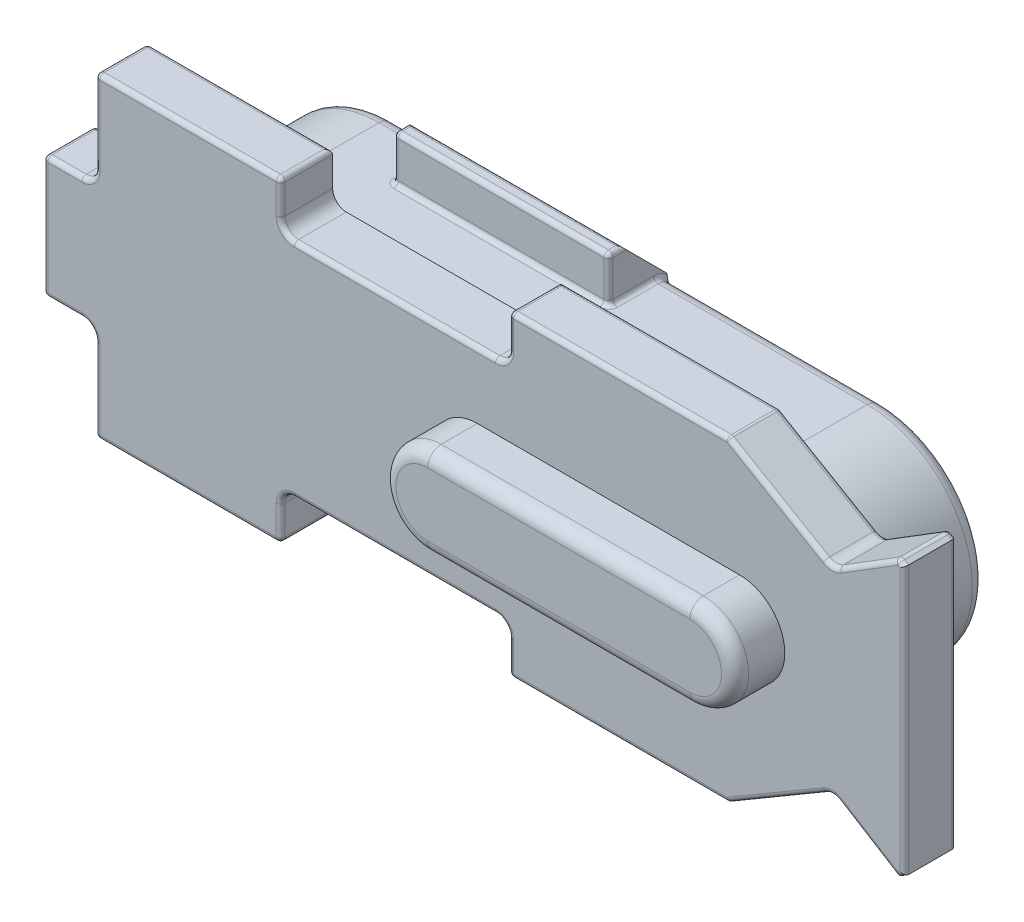
from build123d import *

# Parameters (mm, degrees)
BOSS_EXTRUDE1_DEPTH = 2.921
BOSS_EXTRUDE2_DEPTH = 2.794
BOSS_EXTRUDE3_DEPTH = 6.35
SKETCH4_W           = 12.065
SKETCH4_H           = 2.54
BOSS_EXTRUDE4_DEPTH = 3.302
CUT_EXTRUDE2_DEPTH  = 41.040883374
FILLET1_R           = 0.762
FILLET2_R           = 0.254


with BuildPart() as part:
    # Sketch1 → Boss-Extrude1 (new body)
    with BuildSketch(Plane.XY):
        Polygon((0, -12.319), (0, -5.461), (2.921, -5.461), (2.921, 0), (13.335, 0), (13.335, -2.667), (26.162, -2.667), (26.162, 0), (38.481, 0), (44.323, -3.429), (48.006, -1.143), (48.374224138, -1.359131559), (48.374224138, -16.420868441), (48.006, -16.637), (44.323, -14.351), (38.481, -17.78), (26.162, -17.78), (26.162, -15.113), (13.335, -15.113), (13.335, -17.78), (2.921, -17.78), (2.921, -12.319), align=None)
    extrude(amount=-BOSS_EXTRUDE1_DEPTH)

    # Sketch2 → Boss-Extrude2 (add)
    with BuildSketch(Plane.XY):
        with BuildLine():
            Line((39.116, -11.43), (24.384, -11.43))
            ThreePointArc((24.384, -11.43), (21.844, -8.89), (24.384, -6.35))
            Line((24.384, -6.35), (39.116, -6.35))
            ThreePointArc((39.116, -6.35), (41.656, -8.89), (39.116, -11.43))
        make_face()
    extrude(amount=BOSS_EXTRUDE2_DEPTH)

    # Sketch3 → Boss-Extrude3 (add)
    with BuildSketch(Plane(origin=(0, 0, -2.921), x_dir=(-1, 0, 0), z_dir=(0, 0, -1))):
        with BuildLine():
            Line((-37.7825, -2.9845), (-10.3505, -2.9845))
            ThreePointArc((-10.3505, -2.9845), (-4.445, -8.89), (-10.3505, -14.7955))
            Line((-10.3505, -14.7955), (-37.7825, -14.7955))
            ThreePointArc((-37.7825, -14.7955), (-43.688, -8.89), (-37.7825, -2.9845))
        make_face()
    extrude(amount=BOSS_EXTRUDE3_DEPTH)

    # Sketch4 → Boss-Extrude4 (add)
    with BuildSketch(Plane(origin=(0, 0, -9.271), x_dir=(-1, 0, 0), z_dir=(0, 0, -1))):
        with Locations((-19.7485, -1.7145)):
            Rectangle(SKETCH4_W, SKETCH4_H)
        with Locations((-19.7485, -16.0655)):
            Rectangle(SKETCH4_W, SKETCH4_H)
    extrude(amount=-BOSS_EXTRUDE4_DEPTH)

    # Sketch5 → Cut-Extrude2 (cut, through all)
    with BuildSketch(Plane.ZY.offset(-13.716)):
        Polygon((-9.271, -2.9845), (-6.731, -0.4445), (-9.271, -0.4445), align=None)
        Polygon((-9.271, -17.3355), (-9.271, -14.7955), (-6.731, -17.3355), align=None)
    extrude(amount=-CUT_EXTRUDE2_DEPTH, mode=Mode.SUBTRACT)

    # Fillet1
    fillet1_edges = [part.edges().sort_by_distance(p)[0] for p in [
        (13.335, -2.667, -1.4605),
        (26.162, -2.667, -1.4605),
        (44.323, -3.429, -1.4605),
        (44.323, -14.351, -1.4605),
        (26.162, -15.113, -1.4605),
        (13.335, -15.113, -1.4605),
        (2.921, -12.319, -1.4605),
        (2.921, -5.461, -1.4605),
        (41.656, -8.89, 2.794),
        (31.75, -6.35, 2.794),
        (21.844, -8.89, 2.794),
        (31.75, -11.43, 2.794),
        (43.688, -8.89, -9.271),
        (31.78175, -14.7955, -9.271),
        (4.445, -8.89, -9.271),
        (12.03325, -2.9845, -9.271),
        (31.78175, -2.9845, -9.271),
        (12.03325, -14.7955, -9.271),
    ]]
    fillet(fillet1_edges, radius=FILLET1_R)

    # Fillet2
    # the kernel refuses this fillet: 0.254 mm, written as the material it adds along each edge
    with BuildSketch(Plane(origin=(25.781, -14.0335, -8.509), x_dir=(0, -1, 0), z_dir=(0, 0, 1))) as fillet2_piece_1_section:
        with BuildLine():
            CenterArc((0.762 + FILLET2_R, FILLET2_R), FILLET2_R, 180, 90)
            Line((0.762 + FILLET2_R, 0), (0.762, 0))
            Line((0.762, 0), (0.762, FILLET2_R))
        make_face()
    fillet2_piece_1 = revolve(axis=Axis((25.781, -14.0335, -8.509), (1, 0, 0)), revolution_arc=137.765663079, mode=Mode.PRIVATE)
    fillet2_piece_1 = split(fillet2_piece_1, bisect_by=Plane(origin=(25.781, -14.0335, -9.271), z_dir=(0, 0, 1)), keep=Keep.TOP, mode=Mode.PRIVATE)
    add(fillet2_piece_1)
    with BuildSketch(Plane(origin=(13.716, -14.0335, -8.509), x_dir=(0, -1, 0), z_dir=(0, 0, 1))) as fillet2_piece_2_section:
        with BuildLine():
            CenterArc((0.762 + FILLET2_R, -FILLET2_R), FILLET2_R, 90, 90)
            Line((0.762 + FILLET2_R, 0), (0.762, 0))
            Line((0.762, 0), (0.762, -FILLET2_R))
        make_face()
    fillet2_piece_2 = revolve(axis=Axis((13.716, -14.0335, -8.509), (1, 0, 0)), revolution_arc=137.765663079, mode=Mode.PRIVATE)
    fillet2_piece_2 = split(fillet2_piece_2, bisect_by=Plane(origin=(13.716, -14.0335, -9.271), z_dir=(0, 0, 1)), keep=Keep.TOP, mode=Mode.PRIVATE)
    add(fillet2_piece_2)
    with BuildSketch(Plane(origin=(10.3505, -14.7955, -2.921), x_dir=(0, -1, 0), z_dir=(1, 0, 0)), Plane(origin=(37.7825, -2.9845, -2.921), x_dir=(0, 1, 0), z_dir=(-1, 0, 0))) as fillet2_piece_3:
        with BuildLine():
            CenterArc((FILLET2_R, FILLET2_R), FILLET2_R, 180, 90)
            Line((0, FILLET2_R), (0, 0))
            Line((0, 0), (FILLET2_R, 0))
        make_face()
    extrude(amount=27.432)
    with BuildSketch(Plane(origin=(37.7825, -8.89, -2.921), x_dir=(0, -1, 0), z_dir=(-1, 0, 0))) as fillet2_piece_4:
        with BuildLine():
            CenterArc((5.9055 + FILLET2_R, -FILLET2_R), FILLET2_R, 90, 90)
            Line((5.9055, -FILLET2_R), (5.9055, 0))
            Line((5.9055, 0), (5.9055 + FILLET2_R, 0))
        make_face()
    revolve(axis=Axis((37.7825, -8.89, -2.921), (0, 0, 1)), revolution_arc=180)
    with BuildSketch(Plane(origin=(25.781, -14.7955, -8.509), x_dir=(1, 0, 0), z_dir=(0, 0, 1))) as fillet2_piece_5:
        with BuildLine():
            CenterArc((FILLET2_R, -FILLET2_R), FILLET2_R, 90, 90)
            Line((0, -FILLET2_R), (0, 0))
            Line((0, 0), (FILLET2_R, 0))
        make_face()
    extrude(amount=2.54)
    with BuildSketch(Plane(origin=(13.716, -14.7955, -8.509), x_dir=(-1, 0, 0), z_dir=(0, 0, 1))) as fillet2_piece_6:
        with BuildLine():
            CenterArc((FILLET2_R, FILLET2_R), FILLET2_R, 180, 90)
            Line((0, FILLET2_R), (0, 0))
            Line((0, 0), (FILLET2_R, 0))
        make_face()
    extrude(amount=2.54)
    with BuildSketch(Plane(origin=(25.781, -14.7955, -5.969), x_dir=(0, 0, 1), z_dir=(-1, 0, 0))) as fillet2_piece_7:
        with BuildLine():
            CenterArc((FILLET2_R, -FILLET2_R), FILLET2_R, 90, 90)
            Line((0, -FILLET2_R), (0, 0))
            Line((0, 0), (FILLET2_R, 0))
        make_face()
    extrude(amount=12.065)
    with BuildSketch(Plane(origin=(10.3505, -8.89, -2.921), x_dir=(0, 1, 0), z_dir=(1, 0, 0))) as fillet2_piece_8:
        with BuildLine():
            CenterArc((5.9055 + FILLET2_R, -FILLET2_R), FILLET2_R, 90, 90)
            Line((5.9055, -FILLET2_R), (5.9055, 0))
            Line((5.9055, 0), (5.9055 + FILLET2_R, 0))
        make_face()
    revolve(axis=Axis((10.3505, -8.89, -2.921), (0, 0, 1)), revolution_arc=180)
    with BuildSketch(Plane(origin=(25.781, -14.7955, -8.509), x_dir=(1, 0, 0), z_dir=(0, 0, 1))) as fillet2_piece_9a_section:
        with BuildLine():
            CenterArc((FILLET2_R, -FILLET2_R), FILLET2_R, 90, 90)
            Line((0, -FILLET2_R), (0, 0))
            Line((0, 0), (FILLET2_R, 0))
        make_face()
    fillet2_piece_9a = extrude(amount=3.175, mode=Mode.PRIVATE)
    fillet2_piece_9a = split(fillet2_piece_9a, bisect_by=Plane(origin=(25.781, -14.7955, -5.969), z_dir=(0, 0, 1)), keep=Keep.TOP, mode=Mode.PRIVATE)
    with BuildSketch(Plane(origin=(26.416, -14.7955, -5.969), x_dir=(0, 0, 1), z_dir=(-1, 0, 0))) as fillet2_piece_9b_section:
        with BuildLine():
            CenterArc((FILLET2_R, -FILLET2_R), FILLET2_R, 90, 90)
            Line((0, -FILLET2_R), (0, 0))
            Line((0, 0), (FILLET2_R, 0))
        make_face()
    fillet2_piece_9b = extrude(amount=12.7, mode=Mode.PRIVATE)
    fillet2_piece_9b = split(fillet2_piece_9b, bisect_by=Plane(origin=(25.781, -14.7955, -5.969), z_dir=(1, 0, 0)), keep=Keep.TOP, mode=Mode.PRIVATE)
    fillet2_piece_9 = fillet2_piece_9a & fillet2_piece_9b
    add(fillet2_piece_9)
    with BuildSketch(Plane(origin=(25.781, -14.7955, -5.969), x_dir=(0, 0, 1), z_dir=(-1, 0, 0))) as fillet2_piece_10a_section:
        with BuildLine():
            CenterArc((FILLET2_R, -FILLET2_R), FILLET2_R, 90, 90)
            Line((0, -FILLET2_R), (0, 0))
            Line((0, 0), (FILLET2_R, 0))
        make_face()
    fillet2_piece_10a = extrude(amount=12.7, mode=Mode.PRIVATE)
    fillet2_piece_10a = split(fillet2_piece_10a, bisect_by=Plane(origin=(13.716, -14.7955, -5.969), z_dir=(-1, 0, 0)), keep=Keep.TOP, mode=Mode.PRIVATE)
    with BuildSketch(Plane(origin=(13.716, -14.7955, -8.509), x_dir=(-1, 0, 0), z_dir=(0, 0, 1))) as fillet2_piece_10b_section:
        with BuildLine():
            CenterArc((FILLET2_R, FILLET2_R), FILLET2_R, 180, 90)
            Line((0, FILLET2_R), (0, 0))
            Line((0, 0), (FILLET2_R, 0))
        make_face()
    fillet2_piece_10b = extrude(amount=3.175, mode=Mode.PRIVATE)
    fillet2_piece_10b = split(fillet2_piece_10b, bisect_by=Plane(origin=(13.716, -14.7955, -5.969), z_dir=(0, 0, 1)), keep=Keep.TOP, mode=Mode.PRIVATE)
    fillet2_piece_10 = fillet2_piece_10a & fillet2_piece_10b
    add(fillet2_piece_10)
    # the kernel refuses this fillet: 0.254 mm, written as the material it takes off along each edge
    with BuildSketch(Plane(origin=(48.009667112, -1.439673947, -2.667), x_dir=(-0.5273628617781428, 0.8496401661981191, 0), z_dir=(0, 0, -1))) as fillet2_2_piece_1_section:
        Polygon((0, 0), (FILLET2_R * 1.02, 0), (FILLET2_R * 1.02, FILLET2_R * 0.615771172164), (FILLET2_R * 0.475107543506, FILLET2_R * 0.902592278996), align=None)
    fillet2_2_piece_1 = extrude(amount=FILLET2_R * 1.02, mode=Mode.PRIVATE)
    fillet2_2_piece_1 = fillet2_2_piece_1 - Plane(origin=(48.009667112, -1.439673947, -2.667), x_dir=(0.012359804319251886, -0.9999236147012379, 0), z_dir=(0, 0, -1)) * Sphere(FILLET2_R, mode=Mode.PRIVATE)
    add(fillet2_2_piece_1, mode=Mode.SUBTRACT)
    with BuildSketch(Plane(origin=(0.254, -5.715, -2.667), x_dir=(-1, 0, 0), z_dir=(0, 0, -1))) as fillet2_2_piece_2_section:
        Polygon((0, 0), (FILLET2_R * 1.02, 0), (FILLET2_R * 1.02, FILLET2_R * 1.02), (0, FILLET2_R * 1.02), align=None)
    fillet2_2_piece_2 = extrude(amount=FILLET2_R * 1.02, mode=Mode.PRIVATE)
    fillet2_2_piece_2 = fillet2_2_piece_2 - Plane(origin=(0.254, -5.715, -2.667), x_dir=(0.7071067811865474, -0.7071067811865477, 0), z_dir=(0, 0, -1)) * Sphere(FILLET2_R, mode=Mode.PRIVATE)
    add(fillet2_2_piece_2, mode=Mode.SUBTRACT)
    with BuildSketch(Plane(origin=(0.254, -12.065, -2.667), x_dir=(0, 0, -1), z_dir=(0, -1, 0))) as fillet2_2_piece_3_section:
        Polygon((0, 0), (FILLET2_R * 1.02, 0), (FILLET2_R * 1.02, -FILLET2_R * 1.02), (0, -FILLET2_R * 1.02), align=None)
    fillet2_2_piece_3 = extrude(amount=FILLET2_R * 1.02, mode=Mode.PRIVATE)
    fillet2_2_piece_3 = fillet2_2_piece_3 - Plane(origin=(0.254, -12.065, -2.667), x_dir=(0.7071067811865475, 0, 0.7071067811865475), z_dir=(0, -1, 0)) * Sphere(FILLET2_R, mode=Mode.PRIVATE)
    add(fillet2_2_piece_3, mode=Mode.SUBTRACT)
    with BuildSketch(Plane(origin=(13.97, -0.6985, -6.223), x_dir=(0, 1, 0), z_dir=(0, 0, 1))) as fillet2_2_piece_4_section:
        Polygon((0, 0), (FILLET2_R * 1.02, 0), (FILLET2_R * 1.02, FILLET2_R * 1.02), (0, FILLET2_R * 1.02), align=None)
    fillet2_2_piece_4 = extrude(amount=FILLET2_R * 1.02, mode=Mode.PRIVATE)
    fillet2_2_piece_4 = fillet2_2_piece_4 - Plane(origin=(13.97, -0.6985, -6.223), x_dir=(0.707106781186548, -0.707106781186547, 0), z_dir=(0, 0, 1)) * Sphere(FILLET2_R, mode=Mode.PRIVATE)
    add(fillet2_2_piece_4, mode=Mode.SUBTRACT)
    with BuildSketch(Plane(origin=(25.527, -0.6985, -6.223), x_dir=(0, 1, 0), z_dir=(0, 0, 1))) as fillet2_2_piece_5_section:
        Polygon((0, 0), (FILLET2_R * 1.02, 0), (FILLET2_R * 1.02, -FILLET2_R * 1.02), (0, -FILLET2_R * 1.02), align=None)
    fillet2_2_piece_5 = extrude(amount=FILLET2_R * 1.02, mode=Mode.PRIVATE)
    fillet2_2_piece_5 = fillet2_2_piece_5 - Plane(origin=(25.527, -0.6985, -6.223), x_dir=(-0.7071067811865475, -0.7071067811865475, 0), z_dir=(0, 0, 1)) * Sphere(FILLET2_R, mode=Mode.PRIVATE)
    add(fillet2_2_piece_5, mode=Mode.SUBTRACT)
    with BuildSketch(Plane(origin=(3.175, -0.254, -0.254), x_dir=(0, 1, 0), z_dir=(-1, 0, 0))) as fillet2_2_piece_6_section:
        Polygon((0, 0), (FILLET2_R * 1.02, 0), (FILLET2_R * 1.02, -FILLET2_R * 1.02), (0, -FILLET2_R * 1.02), align=None)
    fillet2_2_piece_6 = extrude(amount=FILLET2_R * 1.02, mode=Mode.PRIVATE)
    fillet2_2_piece_6 = fillet2_2_piece_6 - Plane(origin=(3.175, -0.254, -0.254), x_dir=(0, -0.7071067811865475, -0.7071067811865475), z_dir=(-1, 0, 0)) * Sphere(FILLET2_R, mode=Mode.PRIVATE)
    add(fillet2_2_piece_6, mode=Mode.SUBTRACT)
    with BuildSketch(Plane(origin=(13.081, -0.254, -0.254), x_dir=(0, 1, 0), z_dir=(1, 0, 0))) as fillet2_2_piece_7_section:
        Polygon((0, 0), (FILLET2_R * 1.02, 0), (FILLET2_R * 1.02, FILLET2_R * 1.02), (0, FILLET2_R * 1.02), align=None)
    fillet2_2_piece_7 = extrude(amount=FILLET2_R * 1.02, mode=Mode.PRIVATE)
    fillet2_2_piece_7 = fillet2_2_piece_7 - Plane(origin=(13.081, -0.254, -0.254), x_dir=(0, -0.7071067811865475, -0.7071067811865475), z_dir=(1, 0, 0)) * Sphere(FILLET2_R, mode=Mode.PRIVATE)
    add(fillet2_2_piece_7, mode=Mode.SUBTRACT)
    with BuildSketch(Plane(origin=(26.416, -0.254, -0.254), x_dir=(0, 0, 1), z_dir=(-1, 0, 0))) as fillet2_2_piece_8_section:
        Polygon((0, 0), (FILLET2_R * 1.02, 0), (FILLET2_R * 1.02, FILLET2_R * 1.02), (0, FILLET2_R * 1.02), align=None)
    fillet2_2_piece_8 = extrude(amount=FILLET2_R * 1.02, mode=Mode.PRIVATE)
    fillet2_2_piece_8 = fillet2_2_piece_8 - Plane(origin=(26.416, -0.254, -0.254), x_dir=(0, -0.7071067811865475, -0.7071067811865475), z_dir=(-1, 0, 0)) * Sphere(FILLET2_R, mode=Mode.PRIVATE)
    add(fillet2_2_piece_8, mode=Mode.SUBTRACT)
    with BuildSketch(Plane(origin=(38.411963351, -0.254, -0.254), x_dir=(0, 1, 0), z_dir=(0, 0, 1))) as fillet2_2_piece_9_section:
        Polygon((0, 0), (FILLET2_R * 1.02, 0), (FILLET2_R * 1.02, -FILLET2_R * 0.27723378669), (FILLET2_R * 0.879664099497, -FILLET2_R * 0.51632458014), align=None)
    fillet2_2_piece_9 = extrude(amount=FILLET2_R * 1.02, mode=Mode.PRIVATE)
    fillet2_2_piece_9 = fillet2_2_piece_9 - Plane(origin=(38.411963351, -0.254, -0.254), x_dir=(-0.26228249672773757, -0.964991135664087, 0), z_dir=(0, 0, 1)) * Sphere(FILLET2_R, mode=Mode.PRIVATE)
    add(fillet2_2_piece_9, mode=Mode.SUBTRACT)
    with BuildSketch(Plane(origin=(48.009667112, -1.439673947, -0.254), x_dir=(0.5062005687642271, 0.8624157838205264, 0), z_dir=(0, 0, 1))) as fillet2_2_piece_10_section:
        Polygon((0, 0), (FILLET2_R * 1.02, 0), (FILLET2_R * 1.02, FILLET2_R * 0.615771172164), (FILLET2_R * 0.475107543506, FILLET2_R * 0.902592278996), align=None)
    fillet2_2_piece_10 = extrude(amount=FILLET2_R * 1.02, mode=Mode.PRIVATE)
    fillet2_2_piece_10 = fillet2_2_piece_10 - Plane(origin=(48.009667112, -1.439673947, -0.254), x_dir=(0.012359804319251886, -0.9999236147012379, 0), z_dir=(0, 0, 1)) * Sphere(FILLET2_R, mode=Mode.PRIVATE)
    add(fillet2_2_piece_10, mode=Mode.SUBTRACT)
    with BuildSketch(Plane(origin=(38.411963351, -17.526, -0.254), x_dir=(0.5062005687642233, -0.8624157838205287, 0), z_dir=(0, 0, 1))) as fillet2_2_piece_11_section:
        Polygon((0, 0), (FILLET2_R * 1.02, 0), (FILLET2_R * 1.02, -FILLET2_R * 0.27723378669), (FILLET2_R * 0.879664099497, -FILLET2_R * 0.51632458014), align=None)
    fillet2_2_piece_11 = extrude(amount=FILLET2_R * 1.02, mode=Mode.PRIVATE)
    fillet2_2_piece_11 = fillet2_2_piece_11 - Plane(origin=(38.411963351, -17.526, -0.254), x_dir=(-0.2622824967277375, 0.964991135664087, 0), z_dir=(0, 0, 1)) * Sphere(FILLET2_R, mode=Mode.PRIVATE)
    add(fillet2_2_piece_11, mode=Mode.SUBTRACT)
    with BuildSketch(Plane(origin=(26.416, -17.526, -0.254), x_dir=(0, 0, 1), z_dir=(0, -1, 0))) as fillet2_2_piece_12_section:
        Polygon((0, 0), (FILLET2_R * 1.02, 0), (FILLET2_R * 1.02, FILLET2_R * 1.02), (0, FILLET2_R * 1.02), align=None)
    fillet2_2_piece_12 = extrude(amount=FILLET2_R * 1.02, mode=Mode.PRIVATE)
    fillet2_2_piece_12 = fillet2_2_piece_12 - Plane(origin=(26.416, -17.526, -0.254), x_dir=(0.7071067811865475, 0, -0.7071067811865475), z_dir=(0, -1, 0)) * Sphere(FILLET2_R, mode=Mode.PRIVATE)
    add(fillet2_2_piece_12, mode=Mode.SUBTRACT)
    with BuildSketch(Plane(origin=(13.081, -17.526, -0.254), x_dir=(0, 0, 1), z_dir=(0, -1, 0))) as fillet2_2_piece_13_section:
        Polygon((0, 0), (FILLET2_R * 1.02, 0), (FILLET2_R * 1.02, -FILLET2_R * 1.02), (0, -FILLET2_R * 1.02), align=None)
    fillet2_2_piece_13 = extrude(amount=FILLET2_R * 1.02, mode=Mode.PRIVATE)
    fillet2_2_piece_13 = fillet2_2_piece_13 - Plane(origin=(13.081, -17.526, -0.254), x_dir=(-0.7071067811865475, 0, -0.7071067811865475), z_dir=(0, -1, 0)) * Sphere(FILLET2_R, mode=Mode.PRIVATE)
    add(fillet2_2_piece_13, mode=Mode.SUBTRACT)
    with BuildSketch(Plane(origin=(3.175, -17.526, -0.254), x_dir=(-1, 0, 0), z_dir=(0, -1, 0))) as fillet2_2_piece_14_section:
        Polygon((0, 0), (FILLET2_R * 1.02, 0), (FILLET2_R * 1.02, -FILLET2_R * 1.02), (0, -FILLET2_R * 1.02), align=None)
    fillet2_2_piece_14 = extrude(amount=FILLET2_R * 1.02, mode=Mode.PRIVATE)
    fillet2_2_piece_14 = fillet2_2_piece_14 - Plane(origin=(3.175, -17.526, -0.254), x_dir=(0.7071067811865475, 0, -0.7071067811865475), z_dir=(0, -1, 0)) * Sphere(FILLET2_R, mode=Mode.PRIVATE)
    add(fillet2_2_piece_14, mode=Mode.SUBTRACT)
    with BuildSketch(Plane(origin=(0.254, -12.065, -0.254), x_dir=(-1, 0, 0), z_dir=(0, -1, 0))) as fillet2_2_piece_15_section:
        Polygon((0, 0), (FILLET2_R * 1.02, 0), (FILLET2_R * 1.02, -FILLET2_R * 1.02), (0, -FILLET2_R * 1.02), align=None)
    fillet2_2_piece_15 = extrude(amount=FILLET2_R * 1.02, mode=Mode.PRIVATE)
    fillet2_2_piece_15 = fillet2_2_piece_15 - Plane(origin=(0.254, -12.065, -0.254), x_dir=(0.7071067811865475, 0, -0.7071067811865475), z_dir=(0, -1, 0)) * Sphere(FILLET2_R, mode=Mode.PRIVATE)
    add(fillet2_2_piece_15, mode=Mode.SUBTRACT)
    with BuildSketch(Plane(origin=(0.254, -5.715, -0.254), x_dir=(-1, 0, 0), z_dir=(0, 1, 0))) as fillet2_2_piece_16_section:
        Polygon((0, 0), (FILLET2_R * 1.02, 0), (FILLET2_R * 1.02, FILLET2_R * 1.02), (0, FILLET2_R * 1.02), align=None)
    fillet2_2_piece_16 = extrude(amount=FILLET2_R * 1.02, mode=Mode.PRIVATE)
    fillet2_2_piece_16 = fillet2_2_piece_16 - Plane(origin=(0.254, -5.715, -0.254), x_dir=(0.7071067811865475, 0, -0.7071067811865475), z_dir=(0, 1, 0)) * Sphere(FILLET2_R, mode=Mode.PRIVATE)
    add(fillet2_2_piece_16, mode=Mode.SUBTRACT)
    with BuildSketch(Plane(origin=(38.411963351, -0.254, -2.667), x_dir=(0.5062005687642234, 0.8624157838205287, 0), z_dir=(0, 0, -1))) as fillet2_2_piece_17_section:
        Polygon((0, 0), (FILLET2_R * 1.02, 0), (FILLET2_R * 1.02, -FILLET2_R * 0.27723378669), (FILLET2_R * 0.879664099497, -FILLET2_R * 0.51632458014), align=None)
    fillet2_2_piece_17 = extrude(amount=FILLET2_R * 1.02, mode=Mode.PRIVATE)
    fillet2_2_piece_17 = fillet2_2_piece_17 - Plane(origin=(38.411963351, -0.254, -2.667), x_dir=(-0.26228249672773757, -0.964991135664087, 0), z_dir=(0, 0, -1)) * Sphere(FILLET2_R, mode=Mode.PRIVATE)
    add(fillet2_2_piece_17, mode=Mode.SUBTRACT)
    with BuildSketch(Plane(origin=(3.175, -0.254, -2.667), x_dir=(0, 1, 0), z_dir=(0, 0, -1))) as fillet2_2_piece_18_section:
        Polygon((0, 0), (FILLET2_R * 1.02, 0), (FILLET2_R * 1.02, -FILLET2_R * 1.02), (0, -FILLET2_R * 1.02), align=None)
    fillet2_2_piece_18 = extrude(amount=FILLET2_R * 1.02, mode=Mode.PRIVATE)
    fillet2_2_piece_18 = fillet2_2_piece_18 - Plane(origin=(3.175, -0.254, -2.667), x_dir=(0.7071067811865475, -0.7071067811865475, 0), z_dir=(0, 0, -1)) * Sphere(FILLET2_R, mode=Mode.PRIVATE)
    add(fillet2_2_piece_18, mode=Mode.SUBTRACT)
    with BuildSketch(Plane(origin=(3.175, -17.526, -2.667), x_dir=(0, 0, -1), z_dir=(0, -1, 0))) as fillet2_2_piece_19_section:
        Polygon((0, 0), (FILLET2_R * 1.02, 0), (FILLET2_R * 1.02, -FILLET2_R * 1.02), (0, -FILLET2_R * 1.02), align=None)
    fillet2_2_piece_19 = extrude(amount=FILLET2_R * 1.02, mode=Mode.PRIVATE)
    fillet2_2_piece_19 = fillet2_2_piece_19 - Plane(origin=(3.175, -17.526, -2.667), x_dir=(0.7071067811865475, 0, 0.7071067811865475), z_dir=(0, -1, 0)) * Sphere(FILLET2_R, mode=Mode.PRIVATE)
    add(fillet2_2_piece_19, mode=Mode.SUBTRACT)
    with BuildSketch(Plane(origin=(38.411963351, -17.526, -2.667), x_dir=(0.5062005687642233, -0.8624157838205287, 0), z_dir=(0, 0, -1))) as fillet2_2_piece_20_section:
        Polygon((0, 0), (FILLET2_R * 1.02, 0), (FILLET2_R * 1.02, FILLET2_R * 0.27723378669), (FILLET2_R * 0.879664099497, FILLET2_R * 0.51632458014), align=None)
    fillet2_2_piece_20 = extrude(amount=FILLET2_R * 1.02, mode=Mode.PRIVATE)
    fillet2_2_piece_20 = fillet2_2_piece_20 - Plane(origin=(38.411963351, -17.526, -2.667), x_dir=(-0.2622824967277375, 0.964991135664087, 0), z_dir=(0, 0, -1)) * Sphere(FILLET2_R, mode=Mode.PRIVATE)
    add(fillet2_2_piece_20, mode=Mode.SUBTRACT)
    with BuildSketch(Plane(origin=(44.713849165, -3.186403967, -2.921), x_dir=(0.5273628617781428, -0.8496401661981191, 0), z_dir=(0.8496401661981191, 0.5273628617781428, 0)), Plane(origin=(44.713849165, -3.186403967, 0), x_dir=(0, 0, -1), z_dir=(0.8496401661981191, 0.5273628617781428, 0))) as fillet2_2_piece_21:
        with BuildLine():
            CenterArc((FILLET2_R, -FILLET2_R), FILLET2_R, 90, 90)
            Line((0, -FILLET2_R), (0, 0))
            Line((0, 0), (FILLET2_R, 0))
        make_face()
    extrude(amount=3.721419851, mode=Mode.SUBTRACT)
    with BuildSketch(Plane(origin=(44.311998664, -2.53897816, -2.921), x_dir=(-0.5062005687642194, -0.8624157838205309, 0), z_dir=(-0.8624157838205309, 0.5062005687642194, 0))) as fillet2_2_piece_22:
        with BuildLine():
            CenterArc((0.762 + FILLET2_R, FILLET2_R), FILLET2_R, 180, 90)
            Line((0.762, FILLET2_R), (0.762, 0))
            Line((0.762, 0), (0.762 + FILLET2_R, 0))
        make_face()
    revolve(axis=Axis((44.311998664, -2.53897816, -2.921), (0, 0, 1)), revolution_arc=62.238527844, mode=Mode.SUBTRACT)
    with BuildSketch(Plane(origin=(0.254, -5.461, -2.921), x_dir=(0, -1, 0), z_dir=(1, 0, 0)), Plane(origin=(2.159, -12.319, 0), x_dir=(0, 0, -1), z_dir=(-1, 0, 0)), Plane(origin=(0.254, -5.461, 0), x_dir=(0, 0, -1), z_dir=(1, 0, 0))) as fillet2_2_piece_23:
        with BuildLine():
            CenterArc((FILLET2_R, -FILLET2_R), FILLET2_R, 90, 90)
            Line((0, -FILLET2_R), (0, 0))
            Line((0, 0), (FILLET2_R, 0))
        make_face()
    extrude(amount=1.905, mode=Mode.SUBTRACT)
    with BuildSketch(Plane(origin=(2.159, -4.699, -2.921), x_dir=(0, -1, 0), z_dir=(-1, 0, 0))) as fillet2_2_piece_24:
        with BuildLine():
            CenterArc((0.762 + FILLET2_R, FILLET2_R), FILLET2_R, 180, 90)
            Line((0.762, FILLET2_R), (0.762, 0))
            Line((0.762, 0), (0.762 + FILLET2_R, 0))
        make_face()
    revolve(axis=Axis((2.159, -4.699, -2.921), (0, 0, 1)), revolution_arc=90, mode=Mode.SUBTRACT)
    with BuildSketch(Plane(origin=(2.159, -12.319, -2.921), x_dir=(0, 0, 1), z_dir=(-1, 0, 0))) as fillet2_2_piece_25:
        with BuildLine():
            CenterArc((FILLET2_R, FILLET2_R), FILLET2_R, 180, 90)
            Line((0, FILLET2_R), (0, 0))
            Line((0, 0), (FILLET2_R, 0))
        make_face()
    extrude(amount=1.905, mode=Mode.SUBTRACT)
    with BuildSketch(Plane(origin=(2.159, -13.081, -2.921), x_dir=(0, 1, 0), z_dir=(-1, 0, 0))) as fillet2_2_piece_26:
        with BuildLine():
            CenterArc((0.762 + FILLET2_R, -FILLET2_R), FILLET2_R, 90, 90)
            Line((0.762, -FILLET2_R), (0.762, 0))
            Line((0.762, 0), (0.762 + FILLET2_R, 0))
        make_face()
    revolve(axis=Axis((2.159, -13.081, -2.921), (0, 0, -1)), revolution_arc=90, mode=Mode.SUBTRACT)
    with BuildSketch(Plane(origin=(48.545521506, -16.971875417, -2.921), x_dir=(0.5273628617781433, 0.849640166198119, 0), z_dir=(-0.849640166198119, 0.5273628617781432, 0)), Plane(origin=(48.545521506, -16.971875417, 0), x_dir=(0, 0, -1), z_dir=(-0.849640166198119, 0.5273628617781432, 0))) as fillet2_2_piece_27:
        with BuildLine():
            CenterArc((FILLET2_R, -FILLET2_R), FILLET2_R, 90, 90)
            Line((0, -FILLET2_R), (0, 0))
            Line((0, 0), (FILLET2_R, 0))
        make_face()
    extrude(amount=4.509758947, mode=Mode.SUBTRACT)
    with BuildSketch(Plane(origin=(44.311998664, -15.24102184, -2.921), x_dir=(-0.5062005687642191, 0.8624157838205311, 0), z_dir=(-0.8624157838205311, -0.5062005687642191, 0))) as fillet2_2_piece_28:
        with BuildLine():
            CenterArc((0.762 + FILLET2_R, -FILLET2_R), FILLET2_R, 90, 90)
            Line((0.762, -FILLET2_R), (0.762, 0))
            Line((0.762, 0), (0.762 + FILLET2_R, 0))
        make_face()
    revolve(axis=Axis((44.311998664, -15.24102184, -2.921), (0, 0, -1)), revolution_arc=62.238527844, mode=Mode.SUBTRACT)
    with BuildSketch(Plane(origin=(13.716, -2.9845, -5.969), x_dir=(1, 0, 0), z_dir=(0, 1, 0)), Plane(origin=(25.781, -0.6985, -5.969), x_dir=(-1, 0, 0), z_dir=(0, -1, 0))) as fillet2_2_piece_29:
        with BuildLine():
            CenterArc((FILLET2_R, FILLET2_R), FILLET2_R, 180, 90)
            Line((0, FILLET2_R), (0, 0))
            Line((0, 0), (FILLET2_R, 0))
        make_face()
    extrude(amount=2.286, mode=Mode.SUBTRACT)
    with BuildSketch(Plane(origin=(25.781, -0.4445, -7.366), x_dir=(-1, 0, 0), z_dir=(0, 0, 1))) as fillet2_2_piece_30:
        with BuildLine():
            CenterArc((FILLET2_R, FILLET2_R), FILLET2_R, 180, 90)
            Line((0, FILLET2_R), (0, 0))
            Line((0, 0), (FILLET2_R, 0))
        make_face()
    extrude(amount=1.143, mode=Mode.SUBTRACT)
    with BuildSketch(Plane(origin=(13.97, -0.4445, -5.969), x_dir=(0, -1, 0), z_dir=(1, 0, 0))) as fillet2_2_piece_31:
        with BuildLine():
            CenterArc((FILLET2_R, FILLET2_R), FILLET2_R, 180, 90)
            Line((0, FILLET2_R), (0, 0))
            Line((0, 0), (FILLET2_R, 0))
        make_face()
    extrude(amount=11.557, mode=Mode.SUBTRACT)
    with BuildSketch(Plane(origin=(13.716, -0.4445, -7.366), x_dir=(1, 0, 0), z_dir=(0, 0, 1))) as fillet2_2_piece_32:
        with BuildLine():
            CenterArc((FILLET2_R, -FILLET2_R), FILLET2_R, 90, 90)
            Line((0, -FILLET2_R), (0, 0))
            Line((0, 0), (FILLET2_R, 0))
        make_face()
    extrude(amount=1.143, mode=Mode.SUBTRACT)
    with BuildSketch(Plane(origin=(13.452974388, -0.4445, -6.731), x_dir=(0, 0, 1), z_dir=(1, 0, 0)), Plane(origin=(13.452974388, -17.3355, -6.731), x_dir=(0, 0.7071067811865602, -0.7071067811865349), z_dir=(1, 0, 0))) as fillet2_2_piece_33:
        with BuildLine():
            CenterArc((FILLET2_R * 0.414213562373, FILLET2_R), FILLET2_R, 225, 45)
            Line((-FILLET2_R * 0.292893218813, FILLET2_R * 0.292893218813), (0, 0))
            Line((0, 0), (FILLET2_R * 0.414213562373, 0))
        make_face()
    extrude(amount=12.591051224, mode=Mode.SUBTRACT)
    with BuildSketch(Plane(origin=(13.716, -17.3355, -7.366), x_dir=(0, 1, 0), z_dir=(0, 0, 1))) as fillet2_2_piece_34:
        with BuildLine():
            CenterArc((FILLET2_R, -FILLET2_R), FILLET2_R, 90, 90)
            Line((0, -FILLET2_R), (0, 0))
            Line((0, 0), (FILLET2_R, 0))
        make_face()
    extrude(amount=2.032, mode=Mode.SUBTRACT)
    with BuildSketch(Plane(origin=(13.081, -17.3355, -5.969), x_dir=(0, 0, -1), z_dir=(1, 0, 0))) as fillet2_2_piece_35:
        with BuildLine():
            CenterArc((FILLET2_R, FILLET2_R), FILLET2_R, 180, 90)
            Line((0, FILLET2_R), (0, 0))
            Line((0, 0), (FILLET2_R, 0))
        make_face()
    extrude(amount=13.335, mode=Mode.SUBTRACT)
    with BuildSketch(Plane(origin=(25.781, -17.3355, -7.366), x_dir=(0, 1, 0), z_dir=(0, 0, 1))) as fillet2_2_piece_36:
        with BuildLine():
            CenterArc((FILLET2_R, FILLET2_R), FILLET2_R, 180, 90)
            Line((0, FILLET2_R), (0, 0))
            Line((0, 0), (FILLET2_R, 0))
        make_face()
    extrude(amount=2.032, mode=Mode.SUBTRACT)
    with BuildSketch(Plane(origin=(3.175, 0, 0), x_dir=(0, 0, -1), z_dir=(1, 0, 0)), Plane(origin=(13.081, -17.78, 0), x_dir=(0, 0, -1), z_dir=(-1, 0, 0))) as fillet2_2_piece_37:
        with BuildLine():
            CenterArc((FILLET2_R, -FILLET2_R), FILLET2_R, 90, 90)
            Line((0, -FILLET2_R), (0, 0))
            Line((0, 0), (FILLET2_R, 0))
        make_face()
    extrude(amount=9.906, mode=Mode.SUBTRACT)
    with BuildSketch(Plane(origin=(13.335, -0.254, 0), x_dir=(0, 0, -1), z_dir=(0, -1, 0)), Plane(origin=(26.162, -1.905, 0), x_dir=(0, 0, -1), z_dir=(0, 1, 0)), Plane(origin=(26.162, -17.526, 0), x_dir=(0, 0, -1), z_dir=(0, 1, 0)), Plane(origin=(13.335, -15.875, 0), x_dir=(0, 0, -1), z_dir=(0, -1, 0))) as fillet2_2_piece_38:
        with BuildLine():
            CenterArc((FILLET2_R, -FILLET2_R), FILLET2_R, 90, 90)
            Line((0, -FILLET2_R), (0, 0))
            Line((0, 0), (FILLET2_R, 0))
        make_face()
    extrude(amount=1.651, mode=Mode.SUBTRACT)
    with BuildSketch(Plane(origin=(14.097, -1.905, 0), x_dir=(-1, 0, 0), z_dir=(0, 1, 0))) as fillet2_2_piece_39:
        with BuildLine():
            CenterArc((0.762 + FILLET2_R, -FILLET2_R), FILLET2_R, 90, 90)
            Line((0.762 + FILLET2_R, 0), (0.762, 0))
            Line((0.762, 0), (0.762, -FILLET2_R))
        make_face()
    revolve(axis=Axis((14.097, -1.905, 0), (0, 0, 1)), revolution_arc=90, mode=Mode.SUBTRACT)
    with BuildSketch(Plane(origin=(14.097, -2.667, 0), x_dir=(0, 0, -1), z_dir=(1, 0, 0)), Plane(origin=(25.4, -15.113, 0), x_dir=(0, 0, -1), z_dir=(-1, 0, 0))) as fillet2_2_piece_40:
        with BuildLine():
            CenterArc((FILLET2_R, -FILLET2_R), FILLET2_R, 90, 90)
            Line((0, -FILLET2_R), (0, 0))
            Line((0, 0), (FILLET2_R, 0))
        make_face()
    extrude(amount=11.303, mode=Mode.SUBTRACT)
    with BuildSketch(Plane(origin=(25.4, -1.905, 0), x_dir=(0, -1, 0), z_dir=(-1, 0, 0))) as fillet2_2_piece_41:
        with BuildLine():
            CenterArc((0.762 + FILLET2_R, -FILLET2_R), FILLET2_R, 90, 90)
            Line((0.762 + FILLET2_R, 0), (0.762, 0))
            Line((0.762, 0), (0.762, -FILLET2_R))
        make_face()
    revolve(axis=Axis((25.4, -1.905, 0), (0, 0, 1)), revolution_arc=90, mode=Mode.SUBTRACT)
    with BuildSketch(Plane(origin=(26.416, 0, 0), x_dir=(0, 0, -1), z_dir=(1, 0, 0)), Plane(origin=(38.411963351, -17.78, 0), x_dir=(0, 0, -1), z_dir=(-1, 0, 0))) as fillet2_2_piece_42:
        with BuildLine():
            CenterArc((FILLET2_R, -FILLET2_R), FILLET2_R, 90, 90)
            Line((0, -FILLET2_R), (0, 0))
            Line((0, 0), (FILLET2_R, 0))
        make_face()
    extrude(amount=11.995963351, mode=Mode.SUBTRACT)
    with BuildSketch(Plane(origin=(38.540538296, -0.034946391, 0), x_dir=(0, 0, -1), z_dir=(0.8624157838205287, -0.5062005687642234, 0)), Plane(origin=(43.92627383, -14.583861013, 0), x_dir=(0, 0, -1), z_dir=(-0.8624157838205287, -0.5062005687642233, 0)), Plane(origin=(38.540538296, -0.034946391, -2.921), x_dir=(-0.5062005687642234, -0.8624157838205287, 0), z_dir=(0.8624157838205287, -0.5062005687642234, 0)), Plane(origin=(43.92627383, -14.583861013, -2.921), x_dir=(-0.5062005687642233, 0.8624157838205287, 0), z_dir=(-0.8624157838205287, -0.5062005687642233, 0))) as fillet2_2_piece_43:
        with BuildLine():
            CenterArc((FILLET2_R, -FILLET2_R), FILLET2_R, 90, 90)
            Line((0, -FILLET2_R), (0, 0))
            Line((0, 0), (FILLET2_R, 0))
        make_face()
    extrude(amount=6.244940823, mode=Mode.SUBTRACT)
    with BuildSketch(Plane(origin=(44.311998664, -2.53897816, 0), x_dir=(-0.5062005687642194, -0.8624157838205309, 0), z_dir=(-0.8624157838205309, 0.5062005687642194, 0))) as fillet2_2_piece_44:
        with BuildLine():
            CenterArc((0.762 + FILLET2_R, -FILLET2_R), FILLET2_R, 90, 90)
            Line((0.762 + FILLET2_R, 0), (0.762, 0))
            Line((0.762, 0), (0.762, -FILLET2_R))
        make_face()
    revolve(axis=Axis((44.311998664, -2.53897816, 0), (0, 0, 1)), revolution_arc=62.238527844, mode=Mode.SUBTRACT)
    with BuildSketch(Plane(origin=(48.138242057, -1.220620338, 0), x_dir=(0, 0, -1), z_dir=(0.8624157838205264, -0.5062005687642271, 0)), Plane(origin=(48.138242057, -1.220620338, -2.921), x_dir=(-0.5062005687642273, -0.8624157838205264, 0), z_dir=(0.8624157838205264, -0.5062005687642271, 0))) as fillet2_2_piece_45:
        with BuildLine():
            CenterArc((FILLET2_R, -FILLET2_R), FILLET2_R, 90, 90)
            Line((0, -FILLET2_R), (0, 0))
            Line((0, 0), (FILLET2_R, 0))
        make_face()
    extrude(amount=0.908629131, mode=Mode.SUBTRACT)
    with BuildSketch(Plane(origin=(44.311998664, -15.24102184, 0), x_dir=(-0.5062005687642191, 0.8624157838205311, 0), z_dir=(-0.8624157838205311, -0.5062005687642191, 0))) as fillet2_2_piece_46:
        with BuildLine():
            CenterArc((0.762 + FILLET2_R, FILLET2_R), FILLET2_R, 180, 90)
            Line((0.762 + FILLET2_R, 0), (0.762, 0))
            Line((0.762, 0), (0.762, FILLET2_R))
        make_face()
    revolve(axis=Axis((44.311998664, -15.24102184, 0), (0, 0, -1)), revolution_arc=62.238527844, mode=Mode.SUBTRACT)
    with BuildSketch(Plane(origin=(25.4, -15.875, 0), x_dir=(0, 1, 0), z_dir=(-1, 0, 0))) as fillet2_2_piece_47:
        with BuildLine():
            CenterArc((0.762 + FILLET2_R, FILLET2_R), FILLET2_R, 180, 90)
            Line((0.762 + FILLET2_R, 0), (0.762, 0))
            Line((0.762, 0), (0.762, FILLET2_R))
        make_face()
    revolve(axis=Axis((25.4, -15.875, 0), (0, 0, -1)), revolution_arc=90, mode=Mode.SUBTRACT)
    with BuildSketch(Plane(origin=(14.097, -15.875, 0), x_dir=(-1, 0, 0), z_dir=(0, -1, 0))) as fillet2_2_piece_48:
        with BuildLine():
            CenterArc((0.762 + FILLET2_R, FILLET2_R), FILLET2_R, 180, 90)
            Line((0.762 + FILLET2_R, 0), (0.762, 0))
            Line((0.762, 0), (0.762, FILLET2_R))
        make_face()
    revolve(axis=Axis((14.097, -15.875, 0), (0, 0, -1)), revolution_arc=90, mode=Mode.SUBTRACT)
    with BuildSketch(Plane(origin=(2.921, -17.526, 0), x_dir=(0, 0, -1), z_dir=(0, 1, 0)), Plane(origin=(2.921, -4.699, 0), x_dir=(0, 0, -1), z_dir=(0, 1, 0)), Plane(origin=(2.921, -4.699, -2.921), x_dir=(1, 0, 0), z_dir=(0, 1, 0)), Plane(origin=(2.921, -17.526, -2.921), x_dir=(1, 0, 0), z_dir=(0, 1, 0))) as fillet2_2_piece_49:
        with BuildLine():
            CenterArc((FILLET2_R, -FILLET2_R), FILLET2_R, 90, 90)
            Line((0, -FILLET2_R), (0, 0))
            Line((0, 0), (FILLET2_R, 0))
        make_face()
    extrude(amount=4.445, mode=Mode.SUBTRACT)
    with BuildSketch(Plane(origin=(2.159, -13.081, 0), x_dir=(0, 1, 0), z_dir=(-1, 0, 0))) as fillet2_2_piece_50:
        with BuildLine():
            CenterArc((0.762 + FILLET2_R, FILLET2_R), FILLET2_R, 180, 90)
            Line((0.762 + FILLET2_R, 0), (0.762, 0))
            Line((0.762, 0), (0.762, FILLET2_R))
        make_face()
    revolve(axis=Axis((2.159, -13.081, 0), (0, 0, -1)), revolution_arc=90, mode=Mode.SUBTRACT)
    with BuildSketch(Plane(origin=(0, -12.065, 0), x_dir=(0, 0, -1), z_dir=(0, 1, 0)), Plane(origin=(0, -12.065, -2.921), x_dir=(1, 0, 0), z_dir=(0, 1, 0))) as fillet2_2_piece_51:
        with BuildLine():
            CenterArc((FILLET2_R, -FILLET2_R), FILLET2_R, 90, 90)
            Line((0, -FILLET2_R), (0, 0))
            Line((0, 0), (FILLET2_R, 0))
        make_face()
    extrude(amount=6.35, mode=Mode.SUBTRACT)
    with BuildSketch(Plane(origin=(2.159, -4.699, 0), x_dir=(0, -1, 0), z_dir=(-1, 0, 0))) as fillet2_2_piece_52:
        with BuildLine():
            CenterArc((0.762 + FILLET2_R, -FILLET2_R), FILLET2_R, 90, 90)
            Line((0.762 + FILLET2_R, 0), (0.762, 0))
            Line((0.762, 0), (0.762, -FILLET2_R))
        make_face()
    revolve(axis=Axis((2.159, -4.699, 0), (0, 0, 1)), revolution_arc=90, mode=Mode.SUBTRACT)
    with BuildSketch(Plane(origin=(25.527, 0, -2.921), x_dir=(0, -1, 0), z_dir=(1, 0, 0)), Plane(origin=(38.411963351, -17.78, -2.921), x_dir=(0, 1, 0), z_dir=(-1, 0, 0))) as fillet2_2_piece_53:
        with BuildLine():
            CenterArc((FILLET2_R, -FILLET2_R), FILLET2_R, 90, 90)
            Line((0, -FILLET2_R), (0, 0))
            Line((0, 0), (FILLET2_R, 0))
        make_face()
    extrude(amount=12.884963351, mode=Mode.SUBTRACT)
    with BuildSketch(Plane(origin=(3.175, 0, -2.921), x_dir=(0, -1, 0), z_dir=(1, 0, 0)), Plane(origin=(13.97, -17.78, -2.921), x_dir=(0, 1, 0), z_dir=(-1, 0, 0))) as fillet2_2_piece_54:
        with BuildLine():
            CenterArc((FILLET2_R, -FILLET2_R), FILLET2_R, 90, 90)
            Line((0, -FILLET2_R), (0, 0))
            Line((0, 0), (FILLET2_R, 0))
        make_face()
    extrude(amount=10.795, mode=Mode.SUBTRACT)
    with BuildSketch(Plane(origin=(26.162, -17.78, -0.254), x_dir=(1, 0, 0), z_dir=(0, 0, -1)), Plane(origin=(13.335, -17.78, -0.254), x_dir=(0, 1, 0), z_dir=(0, 0, -1))) as fillet2_2_piece_55:
        with BuildLine():
            CenterArc((FILLET2_R, -FILLET2_R), FILLET2_R, 90, 90)
            Line((0, -FILLET2_R), (0, 0))
            Line((0, 0), (FILLET2_R, 0))
        make_face()
    extrude(amount=3.302, mode=Mode.SUBTRACT)
    with BuildSketch(Plane(origin=(2.921, -17.78, -0.254), x_dir=(1, 0, 0), z_dir=(0, 0, -1)), Plane(origin=(0, -12.319, -0.254), x_dir=(1, 0, 0), z_dir=(0, 0, -1))) as fillet2_2_piece_56:
        with BuildLine():
            CenterArc((FILLET2_R, -FILLET2_R), FILLET2_R, 90, 90)
            Line((0, -FILLET2_R), (0, 0))
            Line((0, 0), (FILLET2_R, 0))
        make_face()
    extrude(amount=2.413, mode=Mode.SUBTRACT)
    with BuildSketch(Plane(origin=(0, -5.461, -0.254), x_dir=(1, 0, 0), z_dir=(0, 0, -1)), Plane(origin=(2.921, 0, -0.254), x_dir=(1, 0, 0), z_dir=(0, 0, -1))) as fillet2_2_piece_57:
        with BuildLine():
            CenterArc((FILLET2_R, FILLET2_R), FILLET2_R, 180, 90)
            Line((0, FILLET2_R), (0, 0))
            Line((0, 0), (FILLET2_R, 0))
        make_face()
    extrude(amount=2.413, mode=Mode.SUBTRACT)
    with BuildSketch(Plane(origin=(13.335, 0, -0.254), x_dir=(0, -1, 0), z_dir=(0, 0, -1)), Plane(origin=(26.162, 0, -0.254), x_dir=(1, 0, 0), z_dir=(0, 0, -1))) as fillet2_2_piece_58:
        with BuildLine():
            CenterArc((FILLET2_R, FILLET2_R), FILLET2_R, 180, 90)
            Line((0, FILLET2_R), (0, 0))
            Line((0, 0), (FILLET2_R, 0))
        make_face()
    extrude(amount=3.302, mode=Mode.SUBTRACT)
    with BuildSketch(Plane(origin=(38.481, 0, -0.254), x_dir=(0.8624157838205493, -0.5062005687641881, 0), z_dir=(0, 0, -1))) as fillet2_2_piece_59:
        with BuildLine():
            CenterArc((FILLET2_R * 0.271797830088, FILLET2_R), FILLET2_R, 239.588918733, 30.411081267)
            Line((-FILLET2_R * 0.234402738676, FILLET2_R * 0.137584216179), (0, 0))
            Line((0, 0), (FILLET2_R * 0.271797830088, 0))
        make_face()
    extrude(amount=2.413, mode=Mode.SUBTRACT)
    with BuildSketch(Plane(origin=(48.006, -1.143, -0.254), x_dir=(0.8624157838205248, -0.50620056876423, 0), z_dir=(0, 0, -1))) as fillet2_2_piece_60:
        with BuildLine():
            CenterArc((FILLET2_R * 0.603697227612, FILLET2_R), FILLET2_R, 207.761472156, 62.238527844)
            Line((-FILLET2_R * 0.281197163561, FILLET2_R * 0.53420829068), (0, 0))
            Line((0, 0), (FILLET2_R * 0.603697227612, 0))
        make_face()
    extrude(amount=2.413, mode=Mode.SUBTRACT)
    with BuildSketch(Plane(origin=(38.481, -17.78, -0.254), x_dir=(0.8624157838205276, 0.5062005687642249, 0), z_dir=(0, 0, -1))) as fillet2_2_piece_61:
        with BuildLine():
            CenterArc((FILLET2_R * 0.271797830088, -FILLET2_R), FILLET2_R, 90, 30.411081267)
            Line((-FILLET2_R * 0.234402738676, -FILLET2_R * 0.137584216179), (0, 0))
            Line((0, 0), (FILLET2_R * 0.271797830088, 0))
        make_face()
    extrude(amount=2.413, mode=Mode.SUBTRACT)
    with BuildSketch(Plane(origin=(48.374224138, -0.724131559, 0), x_dir=(0, 0, -1), z_dir=(0, -1, 0)), Plane(origin=(48.374224138, -0.724131559, -2.921), x_dir=(-1, 0, 0), z_dir=(0, -1, 0))) as fillet2_2_piece_62:
        with BuildLine():
            CenterArc((FILLET2_R, -FILLET2_R), FILLET2_R, 90, 90)
            Line((0, -FILLET2_R), (0, 0))
            Line((0, 0), (FILLET2_R, 0))
        make_face()
    extrude(amount=16.331736882, mode=Mode.SUBTRACT)
    with BuildSketch(Plane(origin=(48.921858161, -16.09943108, 0), x_dir=(0, 0, -1), z_dir=(-0.862415783820524, -0.5062005687642315, 0)), Plane(origin=(48.921858161, -16.09943108, -2.921), x_dir=(-0.5062005687642314, 0.8624157838205239, 0), z_dir=(-0.862415783820524, -0.5062005687642315, 0))) as fillet2_2_piece_63:
        with BuildLine():
            CenterArc((FILLET2_R, -FILLET2_R), FILLET2_R, 90, 90)
            Line((0, -FILLET2_R), (0, 0))
            Line((0, 0), (FILLET2_R, 0))
        make_face()
    extrude(amount=1.696968227, mode=Mode.SUBTRACT)
    # the kernel refuses this fillet: 0.254 mm, written as the material it adds along each edge
    with BuildSketch(Plane(origin=(13.716, -3.7465, -8.509), x_dir=(0, 1, 0), z_dir=(0, 0, 1))) as fillet2_3_piece_1_section:
        with BuildLine():
            CenterArc((0.762 + FILLET2_R, FILLET2_R), FILLET2_R, 180, 90)
            Line((0.762 + FILLET2_R, 0), (0.762, 0))
            Line((0.762, 0), (0.762, FILLET2_R))
        make_face()
    fillet2_3_piece_1 = revolve(axis=Axis((13.716, -3.7465, -8.509), (-1, 0, 0)), revolution_arc=137.765663079, mode=Mode.PRIVATE)
    fillet2_3_piece_1 = split(fillet2_3_piece_1, bisect_by=Plane(origin=(13.716, -3.7465, -9.271), z_dir=(0, 0, 1)), keep=Keep.TOP, mode=Mode.PRIVATE)
    add(fillet2_3_piece_1)
    with BuildSketch(Plane(origin=(13.716, -2.9845, -8.509), x_dir=(-1, 0, 0), z_dir=(0, 0, 1))) as fillet2_3_piece_2:
        with BuildLine():
            CenterArc((FILLET2_R, -FILLET2_R), FILLET2_R, 90, 90)
            Line((0, -FILLET2_R), (0, 0))
            Line((0, 0), (FILLET2_R, 0))
        make_face()
    extrude(amount=2.286)
    with BuildSketch(Plane(origin=(25.781, -3.7465, -8.509), x_dir=(0, 1, 0), z_dir=(0, 0, 1))) as fillet2_3_piece_3_section:
        with BuildLine():
            CenterArc((0.762 + FILLET2_R, -FILLET2_R), FILLET2_R, 90, 90)
            Line((0.762, -FILLET2_R), (0.762, 0))
            Line((0.762, 0), (0.762 + FILLET2_R, 0))
        make_face()
    fillet2_3_piece_3 = revolve(axis=Axis((25.781, -3.7465, -8.509), (-1, 0, 0)), revolution_arc=137.765663079, mode=Mode.PRIVATE)
    fillet2_3_piece_3 = split(fillet2_3_piece_3, bisect_by=Plane(origin=(25.781, -3.7465, -9.271), z_dir=(0, 0, 1)), keep=Keep.TOP, mode=Mode.PRIVATE)
    add(fillet2_3_piece_3)
    with BuildSketch(Plane(origin=(25.527, -2.9845, -5.969), x_dir=(0, 0, 1), z_dir=(-1, 0, 0))) as fillet2_3_piece_4:
        with BuildLine():
            CenterArc((FILLET2_R, FILLET2_R), FILLET2_R, 180, 90)
            Line((0, FILLET2_R), (0, 0))
            Line((0, 0), (FILLET2_R, 0))
        make_face()
    extrude(amount=11.557)
    with BuildSketch(Plane(origin=(25.781, -2.9845, -8.509), x_dir=(1, 0, 0), z_dir=(0, 0, 1))) as fillet2_3_piece_5:
        with BuildLine():
            CenterArc((FILLET2_R, FILLET2_R), FILLET2_R, 180, 90)
            Line((0, FILLET2_R), (0, 0))
            Line((0, 0), (FILLET2_R, 0))
        make_face()
    extrude(amount=2.286)
    with BuildSketch(Plane(origin=(25.527, -2.9845, -6.223), x_dir=(0, 0, 1), z_dir=(-1, 0, 0))) as fillet2_3_piece_6:
        with BuildLine():
            CenterArc((0.254 + FILLET2_R, FILLET2_R), FILLET2_R, 180, 90)
            Line((0.254, FILLET2_R), (0.254, 0))
            Line((0.254, 0), (0.254 + FILLET2_R, 0))
        make_face()
    revolve(axis=Axis((25.527, -2.9845, -6.223), (0, 1, 0)), revolution_arc=90)
    with BuildSketch(Plane(origin=(13.97, -2.9845, -6.223), x_dir=(0, 0, 1), z_dir=(1, 0, 0))) as fillet2_3_piece_7:
        with BuildLine():
            CenterArc((0.254 + FILLET2_R, -FILLET2_R), FILLET2_R, 90, 90)
            Line((0.254, -FILLET2_R), (0.254, 0))
            Line((0.254, 0), (0.254 + FILLET2_R, 0))
        make_face()
    revolve(axis=Axis((13.97, -2.9845, -6.223), (0, -1, 0)), revolution_arc=90)


solid = part.part
